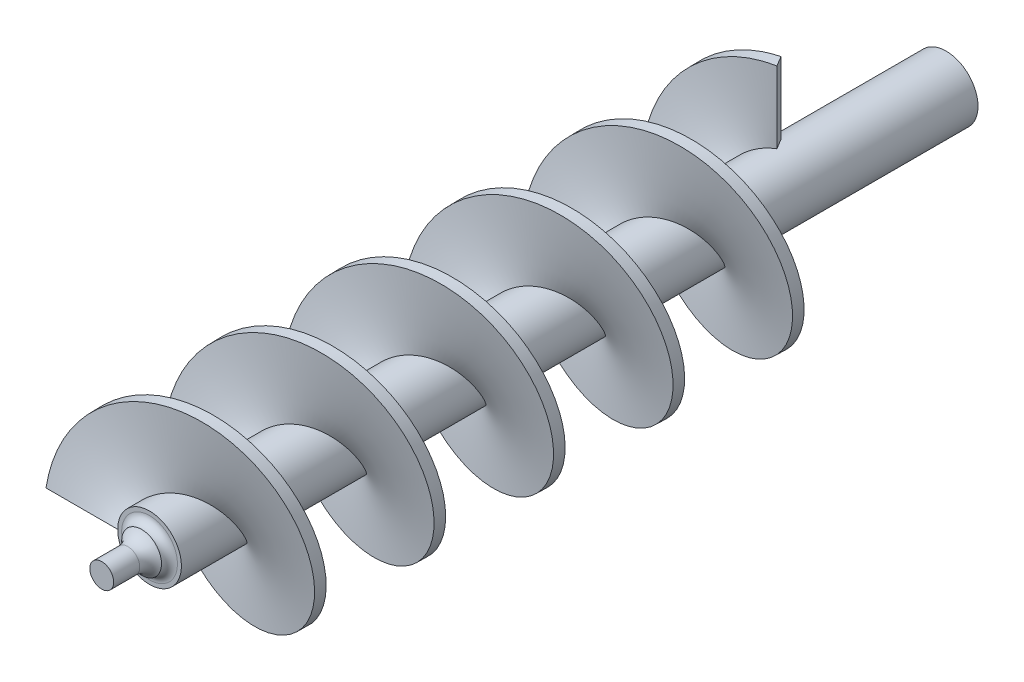
from build123d import *

# Parameters (mm, degrees)
SKETCH1_R           = 4
BOSS_EXTRUDE1_DEPTH = 100
SWEEP1_PITCH        = 15
SWEEP1_HEIGHT       = 78.75
SWEEP1_RADIUS       = 4
SKETCH8_W           = 9
SKETCH8_H           = 1.5
CUT_EXTRUDE1_DEPTH  = 7
SKETCH12_R          = 2.5
BOSS_EXTRUDE2_DEPTH = 1
SKETCH13_R          = 1.5
BOSS_EXTRUDE3_DEPTH = 5
FILLET1_R           = 2
FILLET2_R           = 1


# Some blends are built 0.0001 mm under size
with BuildPart() as part:
    # Sketch1 → Boss-Extrude1 (new body)
    with BuildSketch(Plane.XY):
        Circle(SKETCH1_R)
    extrude(amount=BOSS_EXTRUDE1_DEPTH)

    # Sketch11 → Cut-Extrude1 (cut)
    with BuildSketch(Plane(origin=(0, 0, 0), x_dir=(-1, 0, 0), z_dir=(0, 0, -1))):
        with BuildLine():
            Line((-1.944865034, 1.8), (1.944865034, 1.8))
            ThreePointArc((1.944865034, 1.8), (2.65, 0), (1.944865034, -1.8))
            Line((1.944865034, -1.8), (-1.944865034, -1.8))
            ThreePointArc((-1.944865034, -1.8), (-2.65, 0), (-1.944865034, 1.8))
        make_face()
    extrude(amount=-CUT_EXTRUDE1_DEPTH, mode=Mode.SUBTRACT)

    # Sketch12 → Boss-Extrude2 (add)
    with BuildSketch(Plane.XY.offset(100)):
        Circle(SKETCH12_R)
    extrude(amount=BOSS_EXTRUDE2_DEPTH)

    # Sketch13 → Boss-Extrude3 (add)
    with BuildSketch(Plane.XY.offset(101)):
        Circle(SKETCH13_R)
    extrude(amount=BOSS_EXTRUDE3_DEPTH)

    # Fillet1
    # the kernel refuses this fillet: 2 mm, written as the material it adds along each edge
    with BuildSketch(Plane(origin=(0, 0, 101), x_dir=(1, 0, 0), z_dir=(0, -1, 0))) as fillet1_piece_1:
        with BuildLine():
            CenterArc((3.5, 1.732050808), FILLET1_R, 180, 60)
            Line((1.5, 1.732050808), (1.46, 1.732050808))
            Line((1.46, 1.732050808), (1.46, 0))
            Line((1.46, 0), (1.5, -0.04))
            ThreePointArc((1.5, -0.04), (2, -0.04), (2.48, -0.034641016))
            Line((2.48, -0.034641016), (2.5, 0))
        make_face()
    revolve(axis=Axis((0, 0, 101), (0, 0, 1)))

    # Fillet2
    fillet2_edges = [part.edges().sort_by_distance(p)[0] for p in [
        (-2.5, 0, 100),
    ]]
    fillet(fillet2_edges, radius=FILLET2_R - 0.0001)  # a hair under: the kernel refuses the full size


with BuildPart() as body_2:
    # Sweep1: sweep along a helix
    with BuildLine() as sweep1_path:
        Helix(SWEEP1_PITCH, SWEEP1_HEIGHT, SWEEP1_RADIUS, center=(0, 0, 100), direction=(0, 0, -1))
    # Sketch8 → Sweep1 (sweep)
    with BuildSketch(Plane(origin=(-4, 0, 100), x_dir=(-1, 0, 0), z_dir=(-4.287623530075322e-15, 0.8586911034037448, -0.5124935013590508))):
        with Locations((4.5, -0.75)):
            Rectangle(SKETCH8_W, SKETCH8_H)
    sweep(path=sweep1_path.line, is_frenet=True)


solid = Compound([part.part, body_2.part])
